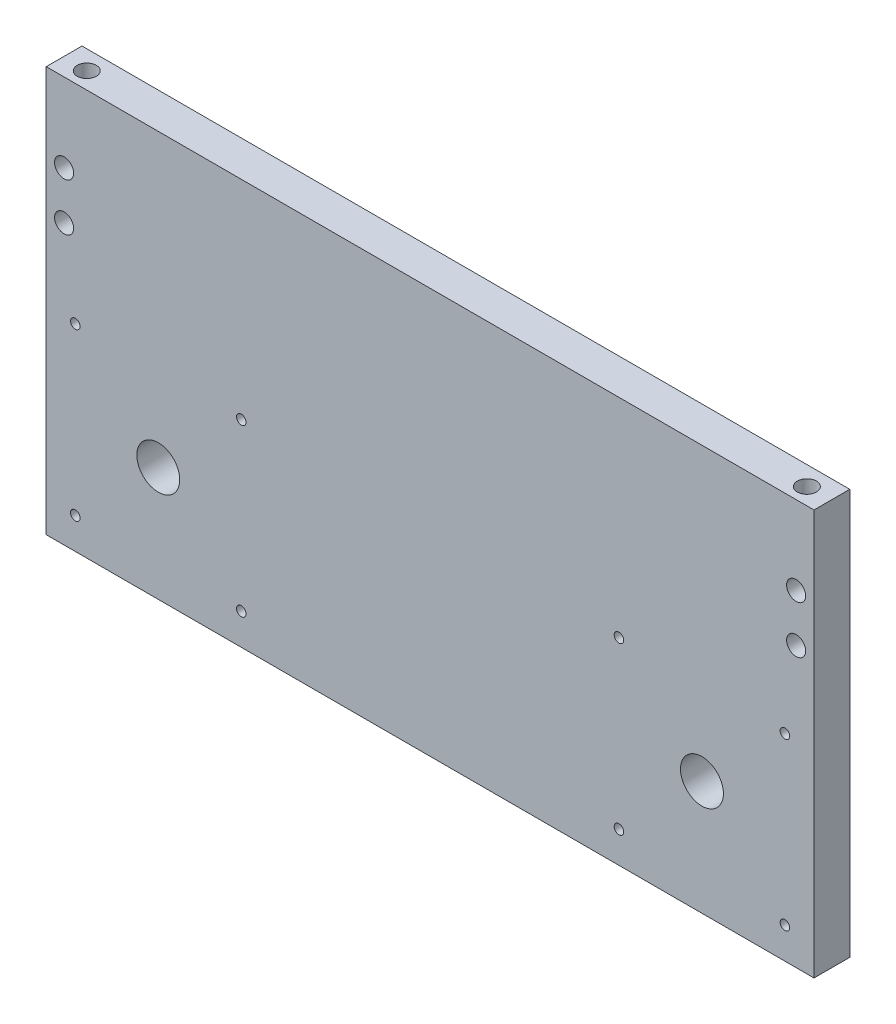
from build123d import *

# Parameters (mm, degrees)
SZKIC1_W                      = 322
SZKIC1_H                      = 170
DODANIE_WYCI_GNI_CIE1_DEPTH   = 15
SZKIC2_R                      = 2
WYTNIJ_WYCI_GNI_CIE2_DEPTH    = 17.75
SZYK_LINIOWY1_COUNT           = 2
SZYK_LINIOWY1_PITCH           = 69.6
SZYK_LINIOWY1_COUNT_DIR2      = 2
SZYK_LINIOWY1_PITCH_DIR2      = 69.6
SZKIC5_R                      = 37.5
WYTNIJ_WYCI_GNI_CIE3_DEPTH    = 2
SZKIC7_R                      = 9
WYTNIJ_WYCI_GNI_CIE4_DEPTH    = 17.75
SZYK_LINIOWY2_COUNT           = 2
SZYK_LINIOWY2_PITCH           = 228
SZYK_LINIOWY2_COPY_1_SKETCH_R = 2
SZYK_LINIOWY2_COPY_1_DEPTH    = 17.75
SZYK_LINIOWY2_COPY_2_SKETCH_R = 2
SZYK_LINIOWY2_COPY_2_DEPTH    = 17.75
SZYK_LINIOWY2_COPY_3_SKETCH_R = 2
SZYK_LINIOWY2_COPY_3_DEPTH    = 17.75
SZKIC8_R                      = 4
WYTNIJ_WYCI_GNI_CIE5_DEPTH    = 20
SZKIC10_R                     = 4
WYTNIJ_WYCI_GNI_CIE7_DEPTH    = 183.677311125
SZKIC11_R                     = 4
WYTNIJ_WYCI_GNI_CIE8_DEPTH    = 183.677311125


with BuildPart() as part:
    # Szkic1 → Dodanie-wyciągnięcie1 (new body)
    with BuildSketch(Plane.XY):
        Rectangle(SZKIC1_W, SZKIC1_H)
    extrude(amount=DODANIE_WYCI_GNI_CIE1_DEPTH)

    # Szkic2 → Wytnij-wyciągnięcie2 (cut)
    with BuildSketch(Plane.XY.offset(15)):
        with Locations((-148.8, -71.87)):
            Circle(SZKIC2_R)
    wytnij_wyci_gni_cie2 = extrude(amount=-WYTNIJ_WYCI_GNI_CIE2_DEPTH, mode=Mode.SUBTRACT)

    # Szyk liniowy1: Wytnij-wyci_gni_cie2 2 × 2
    with Locations(*[(i * SZYK_LINIOWY1_PITCH, j * SZYK_LINIOWY1_PITCH_DIR2, 0) for i in range(SZYK_LINIOWY1_COUNT) for j in range(SZYK_LINIOWY1_COUNT_DIR2) if (i, j) != (0, 0)]):
        add(wytnij_wyci_gni_cie2, mode=Mode.SUBTRACT)

    # Szkic5 → Wytnij-wyciągnięcie3 (cut)
    with BuildSketch(Plane(origin=(0, 0, 0), x_dir=(-1, 0, 0), z_dir=(0, 0, -1))):
        with Locations((114, -37.07)):
            Circle(SZKIC5_R)
    wytnij_wyci_gni_cie3 = extrude(amount=-WYTNIJ_WYCI_GNI_CIE3_DEPTH, mode=Mode.SUBTRACT)

    # Szkic7 → Wytnij-wyciągnięcie4 (cut)
    with BuildSketch(Plane(origin=(0, 0, 2), x_dir=(-1, 0, 0), z_dir=(0, 0, -1))):
        with Locations((114, -37.07)):
            Circle(SZKIC7_R)
    wytnij_wyci_gni_cie4 = extrude(amount=-WYTNIJ_WYCI_GNI_CIE4_DEPTH, mode=Mode.SUBTRACT)

    # Szyk liniowy2: Wytnij-wyciągnięcie2, Wytnij-wyciągnięcie3, Wytnij-wyciągnięcie4 ×2
    with Locations(*[(i * SZYK_LINIOWY2_PITCH, 0, 0) for i in range(1, SZYK_LINIOWY2_COUNT)]):
        add(wytnij_wyci_gni_cie2, mode=Mode.SUBTRACT)
        add(wytnij_wyci_gni_cie3, mode=Mode.SUBTRACT)
        add(wytnij_wyci_gni_cie4, mode=Mode.SUBTRACT)

    # Szyk liniowy2 copy 1 sketch → Szyk liniowy2 copy 1 (cut)
    with BuildSketch(Plane(origin=(228, 69.6, 15), x_dir=(1, 0, 0), z_dir=(0, 0, 1))):
        with Locations((-148.8, -71.87)):
            Circle(SZYK_LINIOWY2_COPY_1_SKETCH_R)
    extrude(amount=-SZYK_LINIOWY2_COPY_1_DEPTH, mode=Mode.SUBTRACT)

    # Szyk liniowy2 copy 2 sketch → Szyk liniowy2 copy 2 (cut)
    with BuildSketch(Plane(origin=(297.6, 0, 15), x_dir=(1, 0, 0), z_dir=(0, 0, 1))):
        with Locations((-148.8, -71.87)):
            Circle(SZYK_LINIOWY2_COPY_2_SKETCH_R)
    extrude(amount=-SZYK_LINIOWY2_COPY_2_DEPTH, mode=Mode.SUBTRACT)

    # Szyk liniowy2 copy 3 sketch → Szyk liniowy2 copy 3 (cut)
    with BuildSketch(Plane(origin=(297.6, 69.6, 15), x_dir=(1, 0, 0), z_dir=(0, 0, 1))):
        with Locations((-148.8, -71.87)):
            Circle(SZYK_LINIOWY2_COPY_3_SKETCH_R)
    extrude(amount=-SZYK_LINIOWY2_COPY_3_DEPTH, mode=Mode.SUBTRACT)

    # Szkic8 → Wytnij-wyciągnięcie5 (cut)
    with BuildSketch(Plane(origin=(0, 85, 0), x_dir=(1, 0, 0), z_dir=(0, 1, 0))):
        with Locations((-151, -8)):
            Circle(SZKIC8_R)
        with Locations((151, -8)):
            Circle(SZKIC8_R)
    extrude(amount=-WYTNIJ_WYCI_GNI_CIE5_DEPTH, mode=Mode.SUBTRACT)

    # Szkic10 → Wytnij-wyciągnięcie7 (cut, through all)
    with BuildSketch(Plane.XY.offset(15)):
        with Locations((-153.5, 52)):
            Circle(SZKIC10_R)
        with Locations((-153.5, 32)):
            Circle(SZKIC10_R)
    extrude(amount=-WYTNIJ_WYCI_GNI_CIE7_DEPTH, mode=Mode.SUBTRACT)

    # Szkic11 → Wytnij-wyciągnięcie8 (cut, through all)
    with BuildSketch(Plane.XY.offset(15)):
        with Locations((153.5, 32)):
            Circle(SZKIC11_R)
        with Locations((153.5, 52)):
            Circle(SZKIC11_R)
    extrude(amount=-WYTNIJ_WYCI_GNI_CIE8_DEPTH, mode=Mode.SUBTRACT)


solid = part.part
